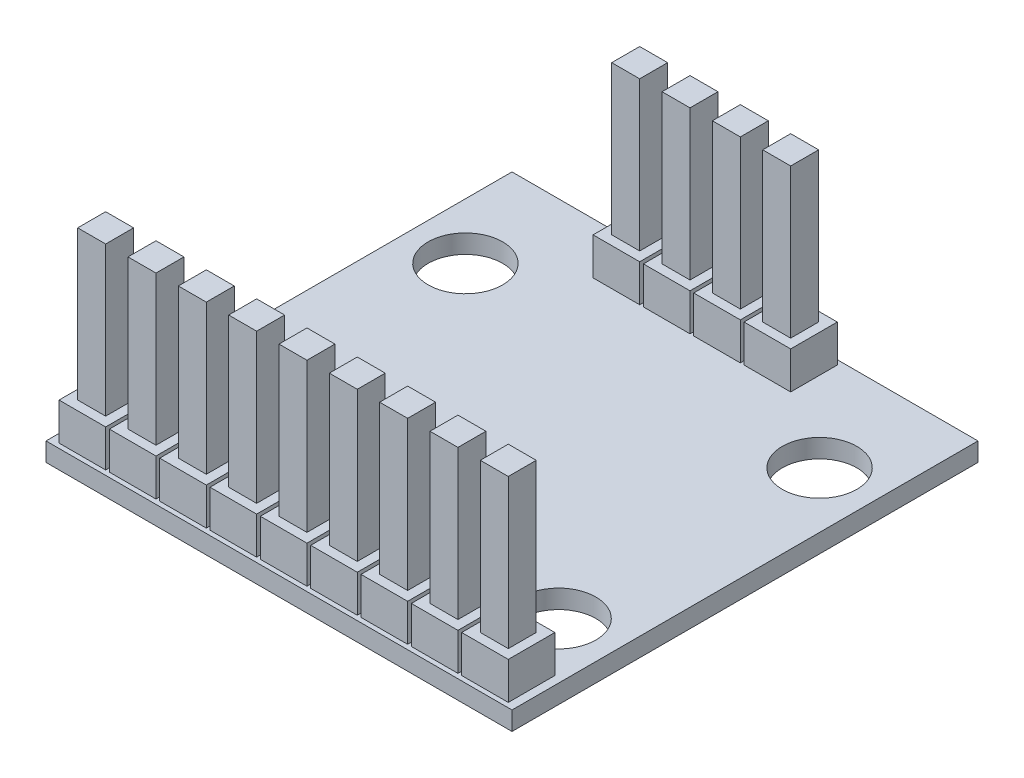
from build123d import *

# Parameters (mm, degrees)
SKETCH_1_W      = 25
SKETCH_1_H      = 25
SKETCH_1_R      = 2
SKETCH_1_W_2    = 2.5
SKETCH_1_H_2    = 2.5
EXTRUDE_1_DEPTH = 1
SKETCH_1_4_W    = 2.5
SKETCH_1_4_H    = 2.5
EXTRUDE_3_DEPTH = 3
SKETCH_3_W      = 1.5
SKETCH_3_H      = 1.5
EXTRUDE_4_DEPTH = 8
SCALE_1_SCALE   = 0.04


with BuildPart() as part:
    # Эскиз1 → Бобышка-Вытянуть1 (new body)
    with BuildSketch(Plane(origin=(0, 0, 0), x_dir=(1, 0, 0), z_dir=(0, 1, 0))):
        Rectangle(SKETCH_1_W, SKETCH_1_H)
        with Locations((-9.5, 7)):
            Circle(SKETCH_1_R, mode=Mode.SUBTRACT)
        with Locations((9.5, 7)):
            Circle(SKETCH_1_R, mode=Mode.SUBTRACT)
        with Locations((9.5, -7)):
            Circle(SKETCH_1_R, mode=Mode.SUBTRACT)
        with Locations((-9.5, -7)):
            Circle(SKETCH_1_R, mode=Mode.SUBTRACT)
        with Locations((2.7, -11)):
            Rectangle(SKETCH_1_W_2, SKETCH_1_H_2, mode=Mode.SUBTRACT)
        with Locations((0, -11)):
            Rectangle(SKETCH_1_W_2, SKETCH_1_H_2, mode=Mode.SUBTRACT)
        with Locations((-2.7, -11)):
            Rectangle(SKETCH_1_W_2, SKETCH_1_H_2, mode=Mode.SUBTRACT)
        with Locations((-5.4, -11)):
            Rectangle(SKETCH_1_W_2, SKETCH_1_H_2, mode=Mode.SUBTRACT)
        with Locations((-8.1, -11)):
            Rectangle(SKETCH_1_W_2, SKETCH_1_H_2, mode=Mode.SUBTRACT)
        with Locations((-10.8, -11)):
            Rectangle(SKETCH_1_W_2, SKETCH_1_H_2, mode=Mode.SUBTRACT)
        with Locations((1.25, 11)):
            Rectangle(SKETCH_1_W_2, SKETCH_1_H_2, mode=Mode.SUBTRACT)
        with Locations((-1.45, 11)):
            Rectangle(SKETCH_1_W_2, SKETCH_1_H_2, mode=Mode.SUBTRACT)
        with Locations((3.95, 11)):
            Rectangle(SKETCH_1_W_2, SKETCH_1_H_2, mode=Mode.SUBTRACT)
        with Locations((-4.15, 11)):
            Rectangle(SKETCH_1_W_2, SKETCH_1_H_2, mode=Mode.SUBTRACT)
        with Locations((5.4, -11)):
            Rectangle(SKETCH_1_W_2, SKETCH_1_H_2, mode=Mode.SUBTRACT)
        with Locations((8.1, -11)):
            Rectangle(SKETCH_1_W_2, SKETCH_1_H_2, mode=Mode.SUBTRACT)
        with Locations((10.8, -11)):
            Rectangle(SKETCH_1_W_2, SKETCH_1_H_2, mode=Mode.SUBTRACT)
    extrude(amount=EXTRUDE_1_DEPTH)

    # Эскиз1<4> → Бобышка-Вытянуть3 (add)
    with BuildSketch(Plane(origin=(0, 0, 0), x_dir=(1, 0, 0), z_dir=(0, 1, 0))):
        with Locations((2.7, -11)):
            Rectangle(SKETCH_1_4_W, SKETCH_1_4_H)
        with Locations((0, -11)):
            Rectangle(SKETCH_1_4_W, SKETCH_1_4_H)
        with Locations((-2.7, -11)):
            Rectangle(SKETCH_1_4_W, SKETCH_1_4_H)
        with Locations((-5.4, -11)):
            Rectangle(SKETCH_1_4_W, SKETCH_1_4_H)
        with Locations((-8.1, -11)):
            Rectangle(SKETCH_1_4_W, SKETCH_1_4_H)
        with Locations((-10.8, -11)):
            Rectangle(SKETCH_1_4_W, SKETCH_1_4_H)
        with Locations((1.25, 11)):
            Rectangle(SKETCH_1_4_W, SKETCH_1_4_H)
        with Locations((-1.45, 11)):
            Rectangle(SKETCH_1_4_W, SKETCH_1_4_H)
        with Locations((3.95, 11)):
            Rectangle(SKETCH_1_4_W, SKETCH_1_4_H)
        with Locations((-4.15, 11)):
            Rectangle(SKETCH_1_4_W, SKETCH_1_4_H)
        with Locations((5.4, -11)):
            Rectangle(SKETCH_1_4_W, SKETCH_1_4_H)
        with Locations((8.1, -11)):
            Rectangle(SKETCH_1_4_W, SKETCH_1_4_H)
        with Locations((10.8, -11)):
            Rectangle(SKETCH_1_4_W, SKETCH_1_4_H)
    extrude(amount=EXTRUDE_3_DEPTH)

    # Эскиз3 → Бобышка-Вытянуть4 (add)
    with BuildSketch(Plane(origin=(0, 3, 0), x_dir=(1, 0, 0), z_dir=(0, 1, 0))):
        with Locations((-4.15, 11)):
            Rectangle(SKETCH_3_W, SKETCH_3_H)
        with Locations((-1.45, 11)):
            Rectangle(SKETCH_3_W, SKETCH_3_H)
        with Locations((1.25, 11)):
            Rectangle(SKETCH_3_W, SKETCH_3_H)
        with Locations((3.95, 11)):
            Rectangle(SKETCH_3_W, SKETCH_3_H)
        with Locations((-8.1, -11)):
            Rectangle(SKETCH_3_W, SKETCH_3_H)
        with Locations((-10.8, -11)):
            Rectangle(SKETCH_3_W, SKETCH_3_H)
        with Locations((-5.4, -11)):
            Rectangle(SKETCH_3_W, SKETCH_3_H)
        with Locations((-2.7, -11)):
            Rectangle(SKETCH_3_W, SKETCH_3_H)
        with Locations((0, -11)):
            Rectangle(SKETCH_3_W, SKETCH_3_H)
        with Locations((2.7, -11)):
            Rectangle(SKETCH_3_W, SKETCH_3_H)
        with Locations((5.4, -11)):
            Rectangle(SKETCH_3_W, SKETCH_3_H)
        with Locations((8.1, -11)):
            Rectangle(SKETCH_3_W, SKETCH_3_H)
        with Locations((10.8, -11)):
            Rectangle(SKETCH_3_W, SKETCH_3_H)
    extrude(amount=EXTRUDE_4_DEPTH)


with BuildPart() as part_1:
    # Масштаб1: scaled about (0, 0, 0)
    add(part.part.scale(SCALE_1_SCALE))


solid = part_1.part
